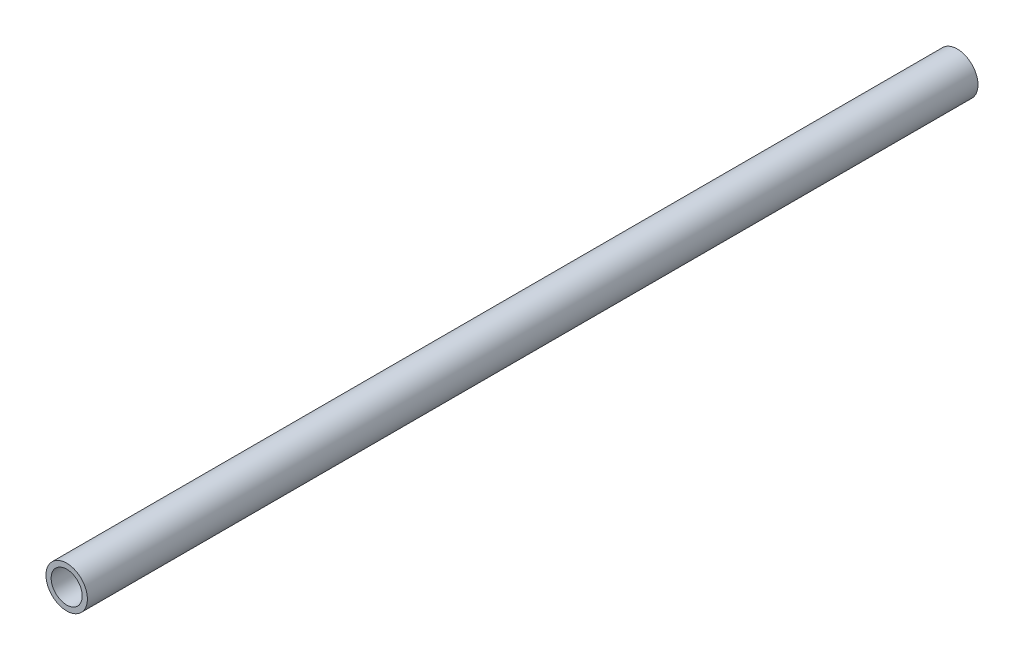
from build123d import *

# Parameters (mm, degrees)
SKETCH2_R           = 12.7
SKETCH2_R_2         = 9.525
BOSS_EXTRUDE1_DEPTH = 273.05


with BuildPart() as part:
    # Sketch2 → Boss-Extrude1 (new, symmetric)
    with BuildSketch(Plane.XY):
        Circle(SKETCH2_R)
        Circle(SKETCH2_R_2, mode=Mode.SUBTRACT)
    extrude(amount=BOSS_EXTRUDE1_DEPTH, both=True)


solid = part.part
